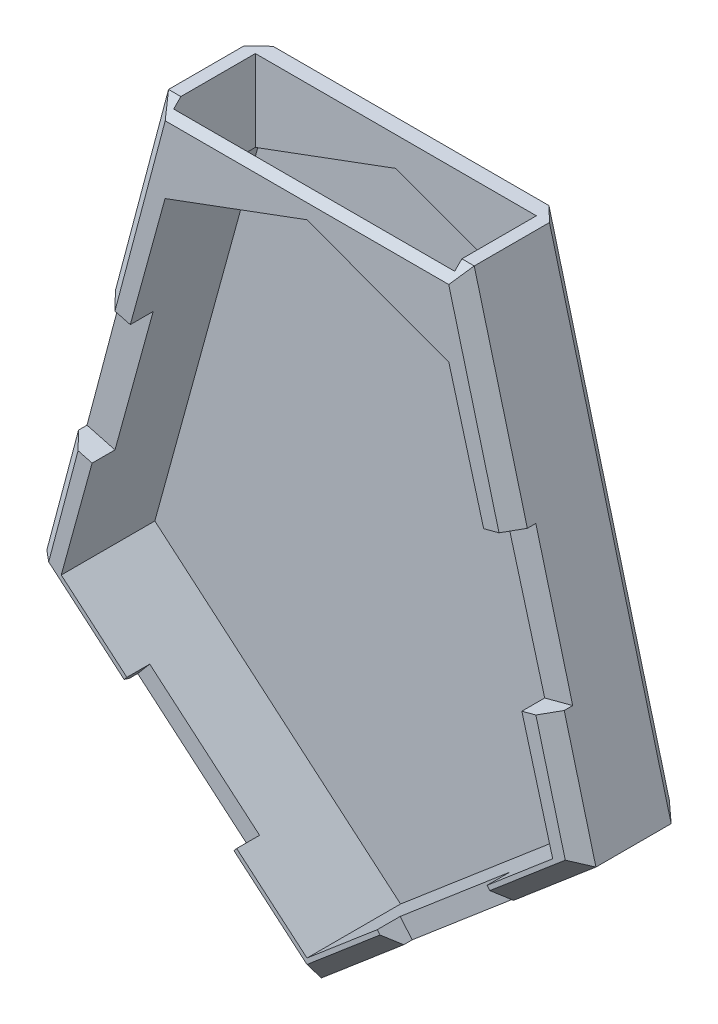
from build123d import *

# Parameters (mm, degrees)
BOSS_EXTRUDE3_DEPTH = 14.43945182
BOSS_EXTRUDE4_DEPTH = 1.453195813
SKETCH3_W           = 39
SKETCH3_H           = 11.33945182
CUT_EXTRUDE2_DEPTH  = 20
SKETCH6_W           = 20
SKETCH6_H           = 3.175
CUT_EXTRUDE3_DEPTH  = 20
SKETCH5_W           = 20
SKETCH5_H           = 3.175
CUT_EXTRUDE4_DEPTH  = 20
SKETCH8_W           = 3.175
SKETCH8_H           = 20
CUT_EXTRUDE5_DEPTH  = 20
SKETCH7_W           = 3.175
SKETCH7_H           = 20
CUT_EXTRUDE6_DEPTH  = 20
CHAMFER1_SIZE       = 2
CHAMFER2_SIZE       = 2


with BuildPart() as part:
    # Sketch1 → Boss-Extrude3 (new body)
    with BuildSketch(Plane.XY):
        Polygon((-59.137511347, -0.038105162), (-21.037511347, -32.416956285), (17.062488653, -0.038105162), (0.174311479, 63.764633586), (-42.249334174, 63.764633586), align=None)
        Polygon((-21.037511347, -29.017601836), (-55.137511347, -0.038105162), (-40.729968911, 52.414123882), (-21.037511347, 59.708444624), (-1.345053783, 52.414123882), (13.062488653, -0.038105162), align=None, mode=Mode.SUBTRACT)
    extrude(amount=BOSS_EXTRUDE3_DEPTH)

    # Sketch1<5> → Boss-Extrude4 (add)
    with BuildSketch(Plane.XY):
        Polygon((-55.137511347, -0.038105162), (-40.729968911, 52.414123882), (-21.037511347, 59.708444624), (-1.345053783, 52.414123882), (13.062488653, -0.038105162), (-21.037511347, -29.017601836), align=None)
    extrude(amount=BOSS_EXTRUDE4_DEPTH)

    # Sketch3 → Cut-Extrude2 (cut)
    with BuildSketch(Plane(origin=(0, 63.764633586, 0), x_dir=(1, 0, 0), z_dir=(0, 1, 0))):
        with Locations((-21.039334174, -7.76972591)):
            Rectangle(SKETCH3_W, SKETCH3_H)
    extrude(amount=-CUT_EXTRUDE2_DEPTH, mode=Mode.SUBTRACT)

    # Sketch6 → Cut-Extrude3 (cut)
    with BuildSketch(Plane(origin=(7.174060124, -8.441673539, 0), x_dir=(0.762, 0.6475770224459791, 0), z_dir=(0.647577022445979, -0.7619999999999999, 0))):
        with Locations((-12.023059674, 12.85195182)):
            Rectangle(SKETCH6_W, SKETCH6_H)
    extrude(amount=-CUT_EXTRUDE3_DEPTH, mode=Mode.SUBTRACT)

    # Sketch5 → Cut-Extrude4 (cut)
    with BuildSketch(Plane(origin=(-24.818473342, -29.203748791, 0), x_dir=(0.762, -0.6475770224459791, 0), z_dir=(-0.647577022445979, -0.7619999999999999, 0))):
        with Locations((-20.038107619, 12.85195182)):
            Rectangle(SKETCH5_W, SKETCH5_H)
    extrude(amount=-CUT_EXTRUDE4_DEPTH, mode=Mode.SUBTRACT)

    # Sketch8 → Cut-Extrude5 (cut)
    with BuildSketch(Plane(origin=(15.935890818, 4.218128451, 0), x_dir=(0, 0, -1), z_dir=(0.9667081628497367, 0.2558814723259324, 0))):
        with Locations((-12.85195182, 22.79218871)):
            Rectangle(SKETCH8_W, SKETCH8_H)
    extrude(amount=-CUT_EXTRUDE5_DEPTH, mode=Mode.SUBTRACT)

    # Sketch7 → Cut-Extrude6 (cut)
    with BuildSketch(Plane(origin=(-55.256037606, 14.625920004, 0), x_dir=(0, 0, 1), z_dir=(-0.9667081628497369, 0.25588147232593195, 0))):
        with Locations((12.85195182, 12.025969955)):
            Rectangle(SKETCH7_W, SKETCH7_H)
    extrude(amount=-CUT_EXTRUDE6_DEPTH, mode=Mode.SUBTRACT)

    # Chamfer1
    # the kernel refuses this chamfer: 2 mm, written as the material it takes off along each edge
    with BuildSketch(Plane(origin=(-53.421537372, 21.556575571, 14.43945182), x_dir=(0.9663426668416519, -0.255784727868533, 0.027495876610586473), z_dir=(-0.255881472325932, -0.9667081628497369, 0))) as chamfer1_piece_1:
        Polygon((CHAMFER1_SIZE * 0.999621916911, -CHAMFER1_SIZE * 0.0274958766106), (-CHAMFER1_SIZE * 0.0274958766106, -CHAMFER1_SIZE * 0.999621916911), (0, 0), align=None)
    extrude(amount=27.481731952, mode=Mode.SUBTRACT)
    with BuildSketch(Plane(origin=(-63.056756221, 3.292620462, 14.43945182), x_dir=(-0.01780569790502669, -0.020951857977268146, -0.9996219169112968), z_dir=(0.762, -0.6475770224459791, 0)), Plane(origin=(-36.386756221, -19.372575324, 14.43945182), x_dir=(-0.017805697905026844, -0.020951857977268323, -0.9996219169112968), z_dir=(0.762, -0.6475770224459791, 0)), Plane(origin=(-24.956756221, -35.747681909, 14.43945182), x_dir=(0.017805697905025137, -0.020951857977266314, -0.9996219169112968), z_dir=(0.762, 0.6475770224459791, 0)), Plane(origin=(1.713243779, -13.082486123, 14.43945182), x_dir=(0.01780569790502548, -0.02095185797726672, -0.9996219169112968), z_dir=(0.762, 0.6475770224459791, 0))) as chamfer1_piece_2:
        Polygon((CHAMFER1_SIZE * 0.999621916911, CHAMFER1_SIZE * 0.0274958766106), (-CHAMFER1_SIZE * 0.0274958766106, CHAMFER1_SIZE * 0.999621916911), (0, 0), align=None)
    extrude(amount=25.286731952, mode=Mode.SUBTRACT)
    with BuildSketch(Plane(origin=(18.378580711, -5.010239036, 14.43945182), x_dir=(0.02658048836416282, 0.007035685390008962, -0.9996219169112968), z_dir=(-0.2558814723259324, 0.9667081628497367, 0))) as chamfer1_piece_3:
        Polygon((CHAMFER1_SIZE * 0.999621916911, CHAMFER1_SIZE * 0.0274958766106), (-CHAMFER1_SIZE * 0.0274958766106, CHAMFER1_SIZE * 0.999621916911), (0, 0), align=None)
    extrude(amount=27.481731952, mode=Mode.SUBTRACT)
    with BuildSketch(Plane(origin=(8.861069348, 30.946471081, 14.43945182), x_dir=(0.026580488364163036, 0.007035685390009019, -0.9996219169112968), z_dir=(-0.2558814723259324, 0.9667081628497367, 0)), Plane(origin=(-40.933242115, 68.736767459, 14.43945182), x_dir=(-0.026580488364161756, 0.007035685390008668, -0.9996219169112968), z_dir=(-0.255881472325932, -0.9667081628497369, 0))) as chamfer1_piece_4:
        Polygon((CHAMFER1_SIZE * 0.999621916911, CHAMFER1_SIZE * 0.0274958766106), (-CHAMFER1_SIZE * 0.0274958766106, CHAMFER1_SIZE * 0.999621916911), (0, 0), align=None)
    extrude(amount=39.091731952, mode=Mode.SUBTRACT)
    with BuildSketch(Plane(origin=(5.317677455, 63.764633586, 14.43945182), x_dir=(0, 0.027495876610585623, -0.9996219169112968), z_dir=(-1, 0, 0))) as chamfer1_piece_5:
        Polygon((CHAMFER1_SIZE * 0.999621916911, CHAMFER1_SIZE * 0.0274958766106), (-CHAMFER1_SIZE * 0.0274958766106, CHAMFER1_SIZE * 0.999621916911), (0, 0), align=None)
    extrude(amount=52.710377605, mode=Mode.SUBTRACT)

    # Chamfer2
    chamfer2_edges = [part.edges().sort_by_distance(p)[0] for p in [
        (-50.693422761, 31.863264212, 0),
        (8.618400066, 31.863264212, 0),
        (-1.987511347, -16.227530724, 0),
        (-40.087511347, -16.227530724, 0),
    ]]
    chamfer(chamfer2_edges, length=CHAMFER2_SIZE)


solid = part.part
